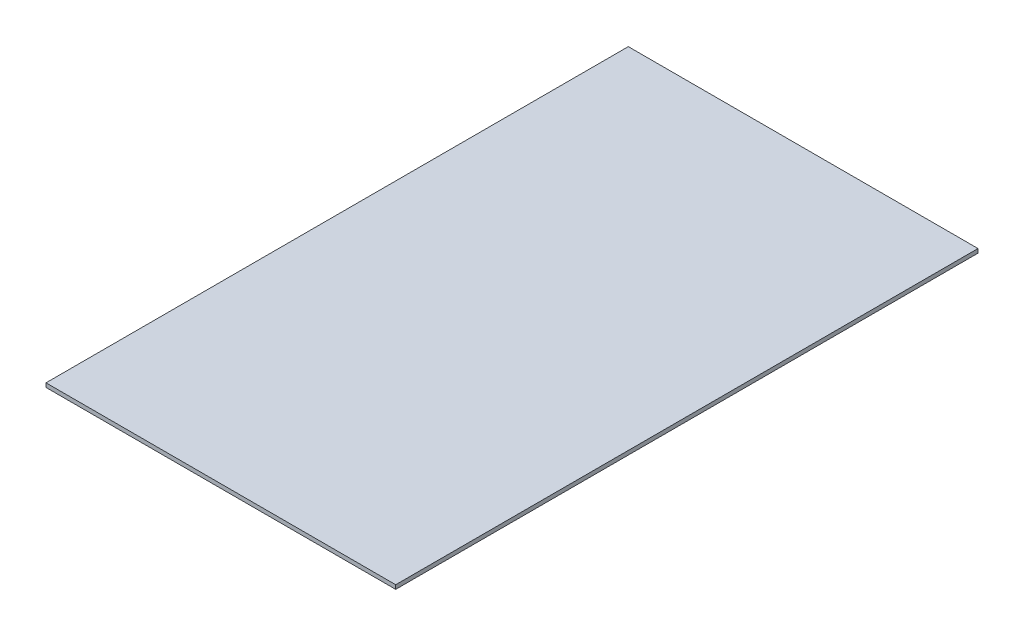
from build123d import *

# Parameters (mm, degrees)
SKETCH1_W           = 274.56892
SKETCH1_H           = 3.175
BOSS_EXTRUDE1_DEPTH = 457.2


with BuildPart() as part:
    # Sketch1 → Boss-Extrude1 (new body)
    with BuildSketch(Plane.XY):
        Rectangle(SKETCH1_W, SKETCH1_H)
    extrude(amount=BOSS_EXTRUDE1_DEPTH)


solid = part.part
